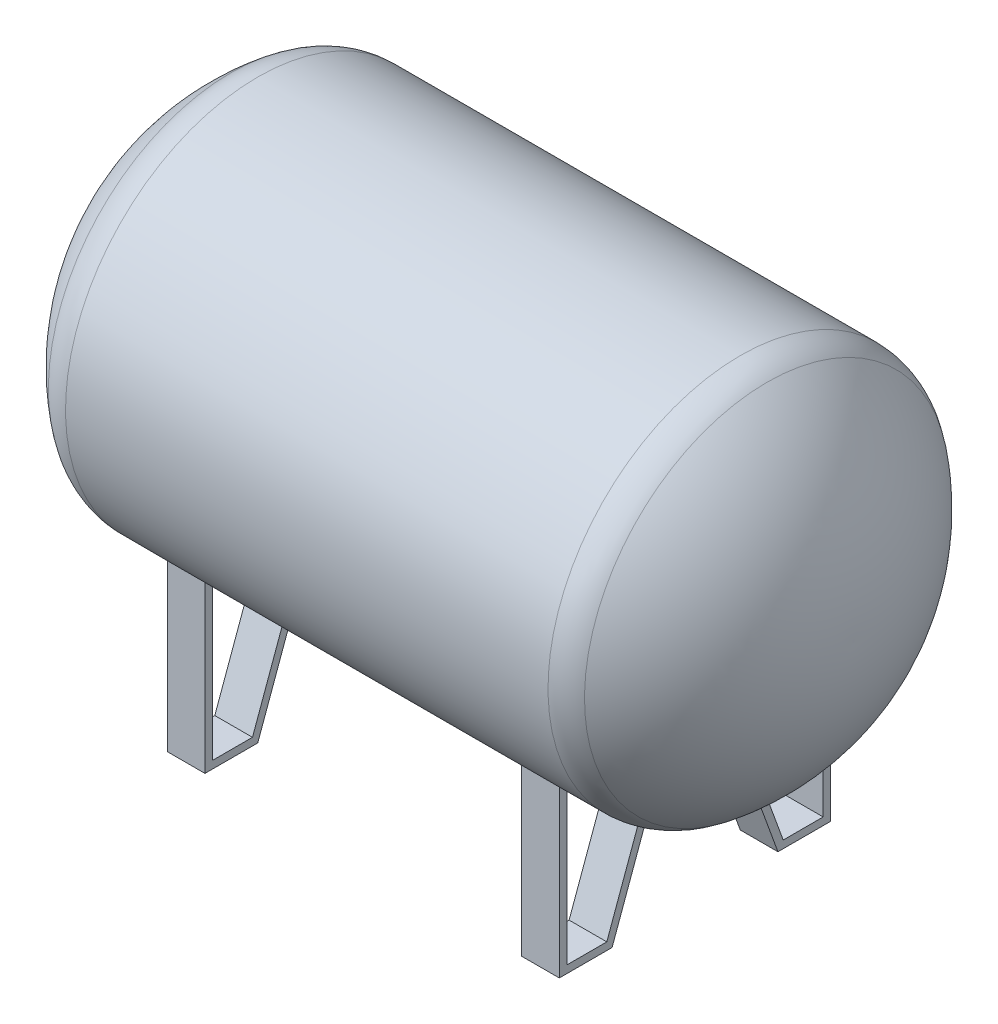
from build123d import *

# Parameters (mm, degrees)
SKETCH1_R                = 510
SKETCH1_R_2              = 500
EXTRUDE_THIN1_DEPTH      = 640
BOSS_EXTRUDE1_REACH      = 2116.954
BOSS_EXTRUDE1_END_RADIUS = 510
SKETCH4_W                = 100
SKETCH4_H                = 20
SKETCH5_W                = 100
SKETCH5_H                = 20
BOSS_EXTRUDE2_DEPTH      = 120
CHAMFER1_SIZE2           = 54.949548389
CHAMFER1_SIZE            = 20
BOSS_EXTRUDE3_REACH      = 2188.809
BOSS_EXTRUDE3_END_RADIUS = 510
SKETCH7_W                = 100
SKETCH7_H                = 20
SKETCH5_2_W              = 100
SKETCH5_2_H              = 20
BOSS_EXTRUDE4_DEPTH      = 115
MIRROR5_START            = -220
MIRROR5_DEPTH            = 100


# Read off the part's stored shape, not the designer's step: Shell2, Mirror5
with BuildPart() as part:
    # Sketch1 → Extrude-Thin1 (new body)
    with BuildSketch(Plane(origin=(0, 0, 0), x_dir=(0, 0, -1), z_dir=(1, 0, 0))):
        Circle(SKETCH1_R)
        Circle(SKETCH1_R_2, mode=Mode.SUBTRACT)
    extrude(amount=-EXTRUDE_THIN1_DEPTH)

    # Sketch3 → Revolve2 (revolve)
    with BuildSketch(Plane.XY):
        with BuildLine():
            Line((0, 510), (0, 0))
            Line((0, 0), (300, 0))
            ThreePointArc((300, 0), (242.622214626, 269.135210935), (71.132598541, 484.349716939))
            ThreePointArc((71.132598541, 484.349716939), (37.639481394, 502.924145188), (0, 510))
        make_face()
    revolve(axis=Axis((300, 0, 0), (-1, 0, 0)))

    # Shell2 outline → Shell2 (revolve, cut)
    with BuildSketch(Plane.YX):
        with BuildLine():
            Line((0, 289.997686127), (0, 0))
            Line((0, 0), (499.996435901, 0))
            ThreePointArc((499.996435901, 0), (493.473636432, 34.367523582), (476.490506402, 64.94933001))
            add(Edge.make_bspline(
                [(476.490506402, 64.94933001), (412.902143842, 145.7729796), (327.84150565, 217.505175066), (225.442664467, 267.412978855), (116.150802911, 290.136485148), (10.231131827, 290.136486709), (7.668298767, 290.122537258), (5.108738263, 290.094706349), (2.552592151, 290.053064812), (0, 289.997686127)],
                knots=[0.666612016, 0.666612016, 0.666612016, 0.666612016, 0.666612016, 0.666612016, 1.570058153, 1.570058153, 1.570058153, 1.570058153, 1.592488002, 1.592488002, 1.592488002, 1.592488002, 1.592488002, 1.592488002], degree=5, weights=[1, 1, 0.995984064, 0.995943782, 1, 1, 0.999999999, 0.999999999, 1, 1]))
        make_face()
    revolve(axis=Axis((0, 0, 0), (1, 0, 0)), mode=Mode.SUBTRACT)

    # Mirror4: part across plane


with BuildPart() as part_1:
    add(part.part)
    add(part.part.mirror(Plane.ZY.offset(640)))

    # Boss-Extrude1: up to this cylinder (the profile starts outside it)
    boss_extrude1_end = Plane(origin=(-170, 0, 0), z_dir=(1, 0, 0)) * Cylinder(BOSS_EXTRUDE1_END_RADIUS, 5254.908, mode=Mode.PRIVATE)
    # Sketch4 → Boss-Extrude1 (add, up to the surface)
    with BuildSketch(Plane(origin=(0, -800, 0), x_dir=(1, 0, 0), z_dir=(0, 1, 0)), mode=Mode.PRIVATE) as boss_extrude1_sk1:
        with Locations((-170, -350)):
            Rectangle(SKETCH4_W, SKETCH4_H)
    boss_extrude1_tool1 = extrude(boss_extrude1_sk1.sketch, amount=BOSS_EXTRUDE1_REACH, mode=Mode.PRIVATE) - boss_extrude1_end
    boss_extrude1 = boss_extrude1_tool1.solids().sort_by_distance((-170, -800, 350))[0]
    add(boss_extrude1)

    # Sketch5 → Boss-Extrude2 (add)
    with BuildSketch(Plane(origin=(0, 0, 340), x_dir=(-1, 0, 0), z_dir=(0, 0, -1))):
        with Locations((170, -790)):
            Rectangle(SKETCH5_W, SKETCH5_H)
    boss_extrude2 = extrude(amount=BOSS_EXTRUDE2_DEPTH)

    # Chamfer1
    chamfer1_edges = [part_1.edges().sort_by_distance(p)[0] for p in [
        (-170, -780, 220),
    ]]
    chamfer1_side = [part_1.faces().sort_by_distance(p)[0] for p in [
        (-170, -780.4, 220),
    ]]
    chamfer(chamfer1_edges, length=CHAMFER1_SIZE - 0.0001, length2=CHAMFER1_SIZE2 - 0.0001, reference=chamfer1_side[0])  # a hair under: the kernel refuses the full size

    # Boss-Extrude3: up to this cylinder (the profile starts outside it)
    boss_extrude3_end = Plane(origin=(-170, 0, 0), z_dir=(1, 0, 0)) * Cylinder(BOSS_EXTRUDE3_END_RADIUS, 5398.618, mode=Mode.PRIVATE)
    # Sketch7 → Boss-Extrude3 (add, up to the surface)
    with BuildSketch(Plane(origin=(0, -777.124414313, 282.850155132), x_dir=(1, 0, 0), z_dir=(0, 0.9396926207859072, -0.3420201433256722)), mode=Mode.PRIVATE) as boss_extrude3_sk1:
        with Locations((-170, 56.883738088)):
            Rectangle(SKETCH7_W, SKETCH7_H)
    boss_extrude3_tool1 = extrude(boss_extrude3_sk1.sketch, amount=BOSS_EXTRUDE3_REACH, mode=Mode.PRIVATE) - boss_extrude3_end
    boss_extrude3 = boss_extrude3_tool1.solids().sort_by_distance((-170, -796.579799, 229.396926))[0]
    add(boss_extrude3)

    # Sketch5<2> → Boss-Extrude4 (add)
    with BuildSketch(Plane(origin=(0, 0, 340), x_dir=(-1, 0, 0), z_dir=(0, 0, -1))):
        with Locations((170, -790)):
            Rectangle(SKETCH5_2_W, SKETCH5_2_H)
    extrude(amount=BOSS_EXTRUDE4_DEPTH)

    # Mirror5 outline → Mirror5 (add)
    with BuildSketch(Plane.YZ.offset(MIRROR5_START)):
        with BuildLine():
            Line((-497.979719354, -110.0736077), (-800, -220))
            Line((-800, -220), (-800, -360))
            Line((-800, -360), (-361.247837364, -360))
            ThreePointArc((-361.247837364, -360), (-370.824555944, -350.127332136), (-380.131556175, -340))
            Line((-380.131556175, -340), (-780, -340))
            Line((-780, -340), (-780, -234.004150764))
            Line((-780, -234.004150764), (-493.249099234, -129.635358236))
            ThreePointArc((-493.249099234, -129.635358236), (-495.710911944, -119.877820214), (-497.979719354, -110.0736077))
        make_face()
    mirror5 = extrude(amount=MIRROR5_DEPTH)

    # Mirror6: Boss-Extrude1, Boss-Extrude2, Boss-Extrude3, Mirror5 across plane
    add(boss_extrude1.mirror(Plane.ZY.offset(640)))
    add(boss_extrude2.mirror(Plane.ZY.offset(640)))
    add(boss_extrude3.mirror(Plane.ZY.offset(640)))
    add(mirror5.mirror(Plane.ZY.offset(640)))


solid = part_1.part
